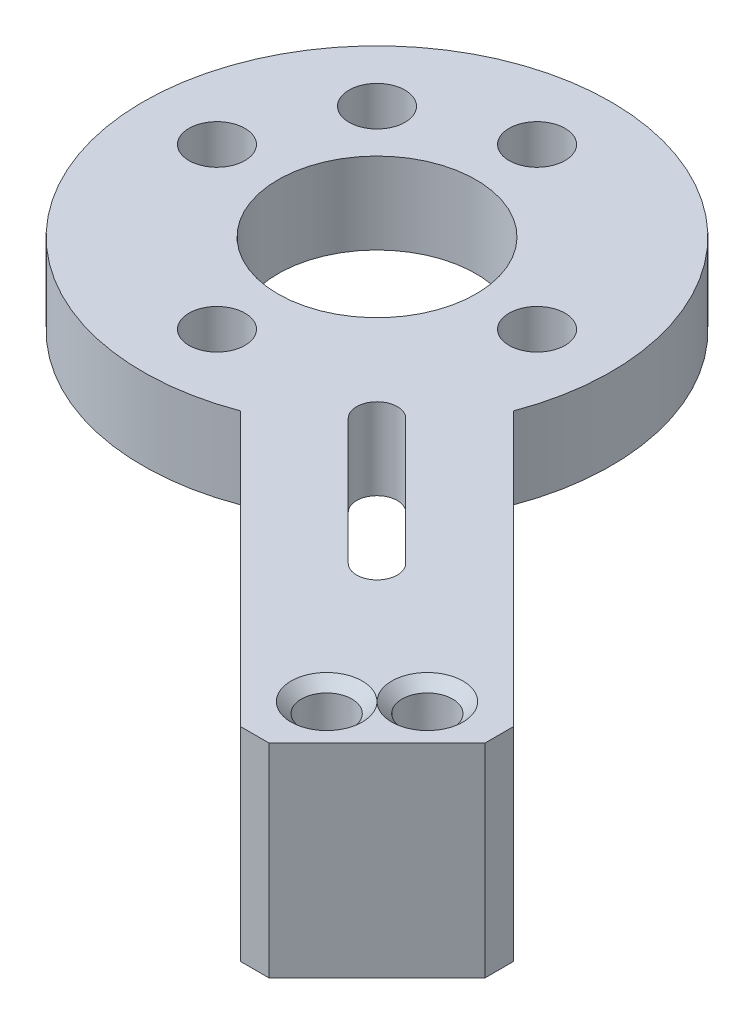
from build123d import *
from OCP.BRepFilletAPI import BRepFilletAPI_MakeChamfer

# Parameters (mm, degrees)
SKETCH2_R               = 2.75
SKETCH2_R_2             = 9.733125881
BOSS_EXTRUDE1_DEPTH     = 8
CHAMFER1_SIZE           = 2
BOSS_EXTRUDE3_DEPTH     = 12
CHAMFER2_SIZE           = 2
CUT_EXTRUDE2_DEPTH      = 82.236487908
CUT_EXTRUDE2_DEPTH_BACK = 82.236487908
CHAMFER3_SIZE           = 1
CHAMFER3_SIZE_2         = 1.020612224


with BuildPart() as part:
    # Sketch2 → Boss-Extrude1 (new body)
    with BuildSketch(Plane(origin=(0, 0, 0), x_dir=(1, 0, 0), z_dir=(0, 1, 0))):
        with BuildLine():
            Line((58.828710372, -43.095584491), (65.546224794, -36.37807007))
            Line((65.546224794, -36.37807007), (37.261953546, -8.093798822))
            ThreePointArc((37.261953546, -8.093798822), (-0.530330086, 16.263455967), (23.826924704, -21.528827665))
            Line((23.826924704, -21.528827665), (52.111195951, -49.813098912))
            Line((52.111195951, -49.813098912), (58.828710372, -43.095584491))
        make_face()
        with Locations(Location((0, 0, 0), (0, 0, 270))):
            Circle(SKETCH2_R, mode=Mode.SUBTRACT)
        with Locations(Location((31.466251763, 0, 0), (0, 0, 270))):
            Circle(SKETCH2_R, mode=Mode.SUBTRACT)
        with Locations(Location((15.733125881, 15.733125881, 0), (0, 0, 270))):
            Circle(SKETCH2_R, mode=Mode.SUBTRACT)
        with Locations(Location((15.733125881, -15.733125881, 0), (0, 0, 270))):
            Circle(SKETCH2_R, mode=Mode.SUBTRACT)
        with Locations(Location((4.608125881, 11.125, 0), (0, 0, 270))):
            Circle(SKETCH2_R, mode=Mode.SUBTRACT)
        with Locations(Location((15.733125881, 0, 0), (0, 0, 270))):
            Circle(SKETCH2_R_2, mode=Mode.SUBTRACT)
    extrude(amount=BOSS_EXTRUDE1_DEPTH)

    # Chamfer1
    chamfer1_edges = [part.edges().sort_by_distance(p)[0] for p in [
        (65.546224794, 4, 36.37807007),
        (52.111195951, 4, 49.813098912),
    ]]
    chamfer(chamfer1_edges, length=CHAMFER1_SIZE)

    # Sketch7 → Boss-Extrude3 (add)
    with BuildSketch(Plane(origin=(0, 0, 0), x_dir=(-1, 0, 0), z_dir=(0, -1, 0))):
        Polygon((-53.525409514, -48.39888535), (-64.132011231, -37.792283632), (-64.132011231, -34.963856507), (-56.016040068, -26.847885344), (-42.581011226, -40.282914187), (-50.696982389, -48.39888535), align=None)
    extrude(amount=BOSS_EXTRUDE3_DEPTH)

    # Sketch8 → Cut-Revolve2 (revolve, cut)
    with BuildSketch(Plane(origin=(47.426613526, 0, 47.426613526), x_dir=(0.7071067811865475, 0, -0.7071067811865477), z_dir=(0.7071067811865477, 0, 0.7071067811865475)), mode=Mode.PRIVATE) as cut_revolve2_sk:
        Polygon((5.525, -12), (5.125, 8), (7.625, 8), (7.625, -12), align=None)
    revolve(cut_revolve2_sk.sketch.rotate(Axis((52.818302732, 8, 42.034924319), (0, -1, 0)), 315), axis=Axis((52.818302732, 8, 42.034924319), (0, -1, 0)), mode=Mode.SUBTRACT)

    # Sketch9 → Cut-Revolve3 (revolve, cut)
    with BuildSketch(Plane(origin=(47.426613526, 0, 47.426613526), x_dir=(0.7071067811865475, 0, -0.7071067811865477), z_dir=(0.7071067811865477, 0, 0.7071067811865475)), mode=Mode.PRIVATE) as cut_revolve3_sk:
        Polygon((14.625, -12), (16.725, -12), (17.125, 8), (14.625, 8), align=None)
    revolve(cut_revolve3_sk.sketch.rotate(Axis((57.768050201, 8, 37.085176851), (0, -1, 0)), 135), axis=Axis((57.768050201, 8, 37.085176851), (0, -1, 0)), mode=Mode.SUBTRACT)

    # Chamfer2
    chamfer2_edges = [part.edges().sort_by_distance(p)[0] for p in [
        (49.298525647, 0, 33.565399766),
    ]]
    chamfer(chamfer2_edges, length=CHAMFER2_SIZE)

    # Sketch10 → Cut-Extrude2 (cut, two sides: drawn at the far end of the back side and taken through both)
    with BuildSketch(Plane.XZ.offset(-CUT_EXTRUDE2_DEPTH_BACK)):
        with BuildLine():
            Line((29.768176219, 16.863477462), (42.110295184, 29.205596427))
            ThreePointArc((42.110295184, 29.205596427), (44.966986546, 29.176755666), (44.880476019, 26.321228875))
            Line((44.880476019, 26.321228875), (32.827718409, 14.312209061))
            ThreePointArc((32.827718409, 14.312209061), (29.901532194, 13.913228795), (29.768176219, 16.863477462))
        make_face()
    extrude(amount=CUT_EXTRUDE2_DEPTH + CUT_EXTRUDE2_DEPTH_BACK, mode=Mode.SUBTRACT)

    # Chamfer3
    chamfer3_edges_1 = [part.edges().sort_by_distance(p)[0] for p in [
        (52.818302732, 8, 39.534924319),
    ]]
    chamfer3_side_1 = [part.faces().sort_by_distance(p)[0] for p in [
        (52.818302732, 8, 39.514924319),
    ]]
    chamfer3_edges_2 = [part.edges().sort_by_distance(p)[0] for p in [
        (57.768050201, 8, 34.585176851),
    ]]
    chamfer3_side_2 = [part.faces().sort_by_distance(p)[0] for p in [
        (57.768050201, 8, 34.565176851),
    ]]
    chamfer3 = BRepFilletAPI_MakeChamfer(part.part.solid().wrapped)
    for e in chamfer3_edges_1:
        chamfer3.Add(CHAMFER3_SIZE - 0.0001, CHAMFER3_SIZE_2 - 0.0001, e.wrapped, chamfer3_side_1[0].wrapped)
    for e in chamfer3_edges_2:
        chamfer3.Add(CHAMFER3_SIZE - 0.0001, CHAMFER3_SIZE_2 - 0.0001, e.wrapped, chamfer3_side_2[0].wrapped)
    add(Compound.cast(chamfer3.Shape()), mode=Mode.REPLACE)  # a hair under: the kernel refuses the full size


solid = part.part
